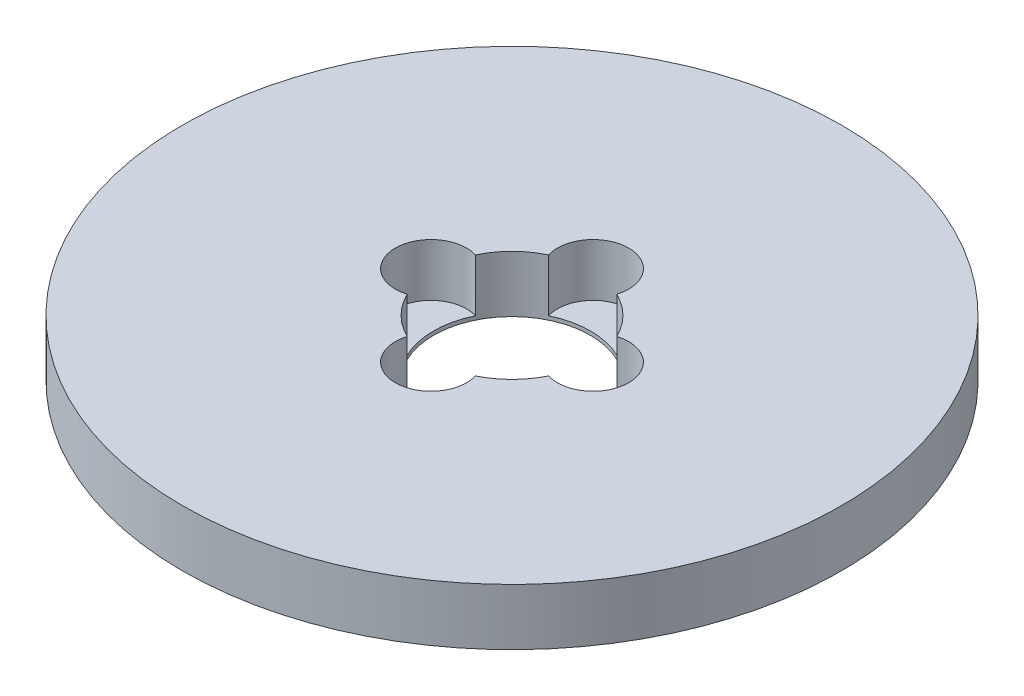
from build123d import *

# Parameters (mm, degrees)
SKETCH1_R           = 52.5
BOSS_EXTRUDE1_DEPTH = 9
SKETCH2_R           = 12.5
CUT_EXTRUDE1_DEPTH  = 75.789705174
SKETCH3_R           = 5.677743223
CUT_EXTRUDE2_DEPTH  = 8.396653789
CIRPATTERN1_COUNT   = 4


with BuildPart() as part:
    # Sketch1 → Boss-Extrude1 (new body)
    with BuildSketch(Plane(origin=(0, 0, 0), x_dir=(1, 0, 0), z_dir=(0, 1, 0))):
        Circle(SKETCH1_R)
    extrude(amount=BOSS_EXTRUDE1_DEPTH)

    # Sketch2 → Cut-Extrude1 (cut, through all)
    with BuildSketch(Plane(origin=(0, 0, 0), x_dir=(1, 0, 0), z_dir=(0, 1, 0))):
        Circle(SKETCH2_R)
    extrude(amount=CUT_EXTRUDE1_DEPTH, mode=Mode.SUBTRACT)

    # Sketch3 → Cut-Extrude2 (cut)
    with BuildSketch(Plane(origin=(0, 9, 0), x_dir=(1, 0, 0), z_dir=(0, 1, 0))):
        with Locations((-12.911355312, 0)):
            Circle(SKETCH3_R)
    cut_extrude2 = extrude(amount=-CUT_EXTRUDE2_DEPTH, mode=Mode.SUBTRACT)

    # CirPattern1: Cut-Extrude2 ×4 about axis
    cirpattern1_axis = Axis((0, 0, 0), (0, 1, 0))
    for i in range(1, CIRPATTERN1_COUNT):
        add(cut_extrude2.rotate(cirpattern1_axis, i * 360 / CIRPATTERN1_COUNT), mode=Mode.SUBTRACT)


solid = part.part
